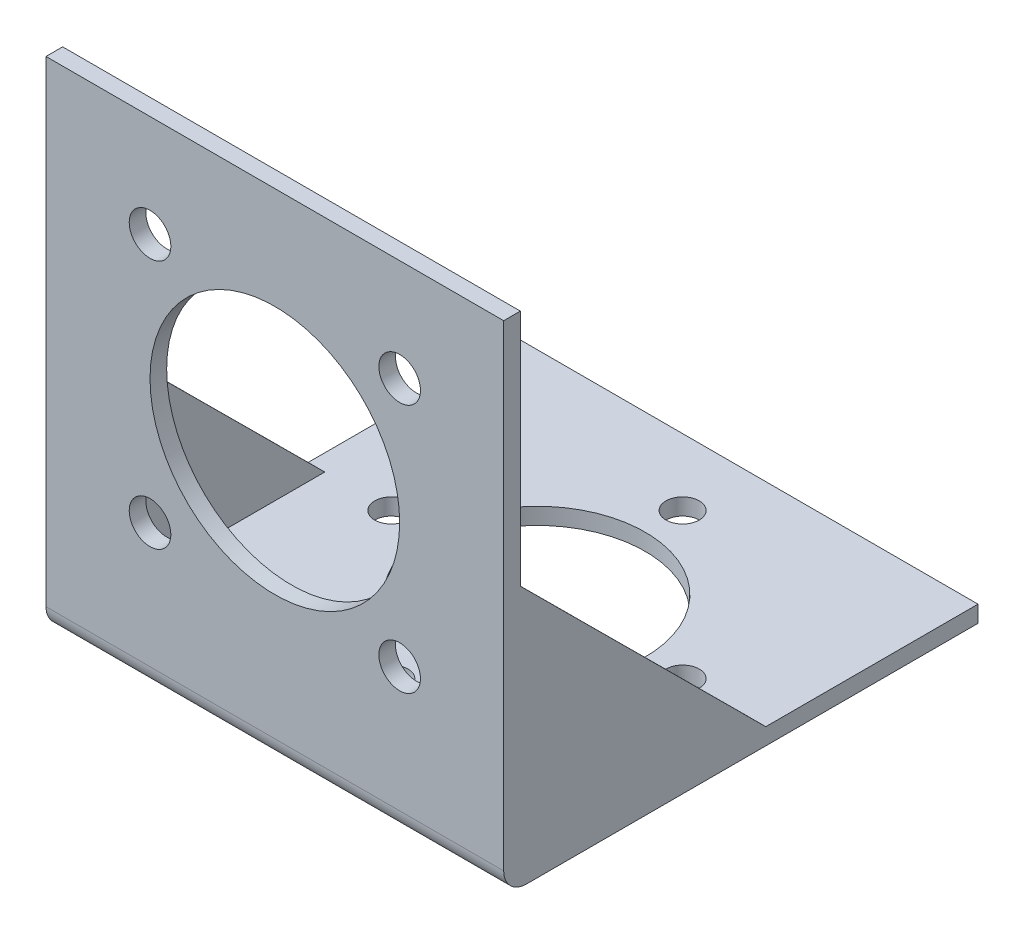
from build123d import *

# Parameters (mm, degrees)
SKETCH_1_W                       = 55
SKETCH_1_H                       = 55
SKETCH_1_R                       = 13
SKETCH_1_R_2                     = 2
SM_BASE_FLANGE_1_DEPTH           = 2
SM_EDGE_FLANGE_1_STRIP_W         = 9.4732
SM_EDGE_FLANGE_1_STRIP_H         = 2
SM_EDGE_FLANGE_1_STRIP_CUT_DEPTH = 55
SM_EDGE_FLANGE_1_DEPTH           = 55
SKETCH_9_R                       = 15
SKETCH_9_R_2                     = 2.5
CUT_EXTRUDE_1_DEPTH              = 10
EXTRUDE_1_DEPTH                  = 2
EXTRUDE_2_DEPTH                  = 2


# Sheet-metal steps are written as plain solids
with BuildPart() as part:
    # Sketch 1 → 基体-法兰1 (new body)
    with BuildSketch(Plane(origin=(0, 0, 0), x_dir=(1, 0, 0), z_dir=(0, 1, 0))):
        with Locations((0, -2)):
            Rectangle(SKETCH_1_W, SKETCH_1_H)
        with Locations(Location((0, 0, 0), (0, 0, 270))):
            Circle(SKETCH_1_R, mode=Mode.SUBTRACT)
        with Locations(Location((17.5, 0, 0), (0, 0, 270))):
            Circle(SKETCH_1_R_2, mode=Mode.SUBTRACT)
        with Locations(Location((-17.5, 0, 0), (0, 0, 270))):
            Circle(SKETCH_1_R_2, mode=Mode.SUBTRACT)
        with Locations(Location((0, 17.5, 0), (0, 0, 270))):
            Circle(SKETCH_1_R_2, mode=Mode.SUBTRACT)
        with Locations(Location((0, -17.5, 0), (0, 0, 270))):
            Circle(SKETCH_1_R_2, mode=Mode.SUBTRACT)
    extrude(amount=-SM_BASE_FLANGE_1_DEPTH)

    # 边线-法兰1 strip (across the edge) → 边线-法兰1 strip cut (cut)
    with BuildSketch(Plane(origin=(-27.5, 0, 29.5), x_dir=(0, 0, -1), z_dir=(1, 0, 0))):
        with Locations((-4, -1)):
            Rectangle(SM_EDGE_FLANGE_1_STRIP_W, SM_EDGE_FLANGE_1_STRIP_H)
    extrude(amount=SM_EDGE_FLANGE_1_STRIP_CUT_DEPTH, mode=Mode.SUBTRACT)

    # 边线-法兰1 section (across the edge) → 边线-法兰1 (add)
    with BuildSketch(Plane(origin=(-27.5, 0, 29.5), x_dir=(0, 0, -1), z_dir=(1, 0, 0))):
        with BuildLine():
            Line((-2, 0.7366), (-2, 58))
            Line((-2, 58), (0, 58))
            Line((0, 58), (0, 0.7366))
            ThreePointArc((0, 0.7366), (0.215745145, 0.215745145), (0.7366, 0))
            Line((0.7366, 0), (0.7366, -2))
            ThreePointArc((0.7366, -2), (-1.198468417, -1.198468417), (-2, 0.7366))
        make_face()
    extrude(amount=SM_EDGE_FLANGE_1_DEPTH)

    # 草图9 → 切除-拉伸1 (cut)
    with BuildSketch(Plane(origin=(0, 0, 29.5), x_dir=(-1, 0, 0), z_dir=(0, 0, -1))):
        with Locations((0, 30.7366)):
            Circle(SKETCH_9_R)
        with Locations((-15, 45.7366)):
            Circle(SKETCH_9_R_2)
        with Locations((-15, 15.7366)):
            Circle(SKETCH_9_R_2)
        with Locations((15, 15.7366)):
            Circle(SKETCH_9_R_2)
        with Locations((15, 45.7366)):
            Circle(SKETCH_9_R_2)
    extrude(amount=-CUT_EXTRUDE_1_DEPTH, mode=Mode.SUBTRACT)

    # 草图10 → 凸台-拉伸1 (add)
    with BuildSketch(Plane(origin=(27.5, 0, 0), x_dir=(0, 0, -1), z_dir=(1, 0, 0))):
        Polygon((-29.5, 29.3683), (0, 0), (-29.5, 0), align=None)
    extrude(amount=-EXTRUDE_1_DEPTH)

    # 草图11 → 凸台-拉伸2 (add)
    with BuildSketch(Plane.ZY.offset(27.5)):
        Polygon((29.5, 29.3683), (0, 0), (29.5, 0), align=None)
    extrude(amount=-EXTRUDE_2_DEPTH)


solid = part.part
